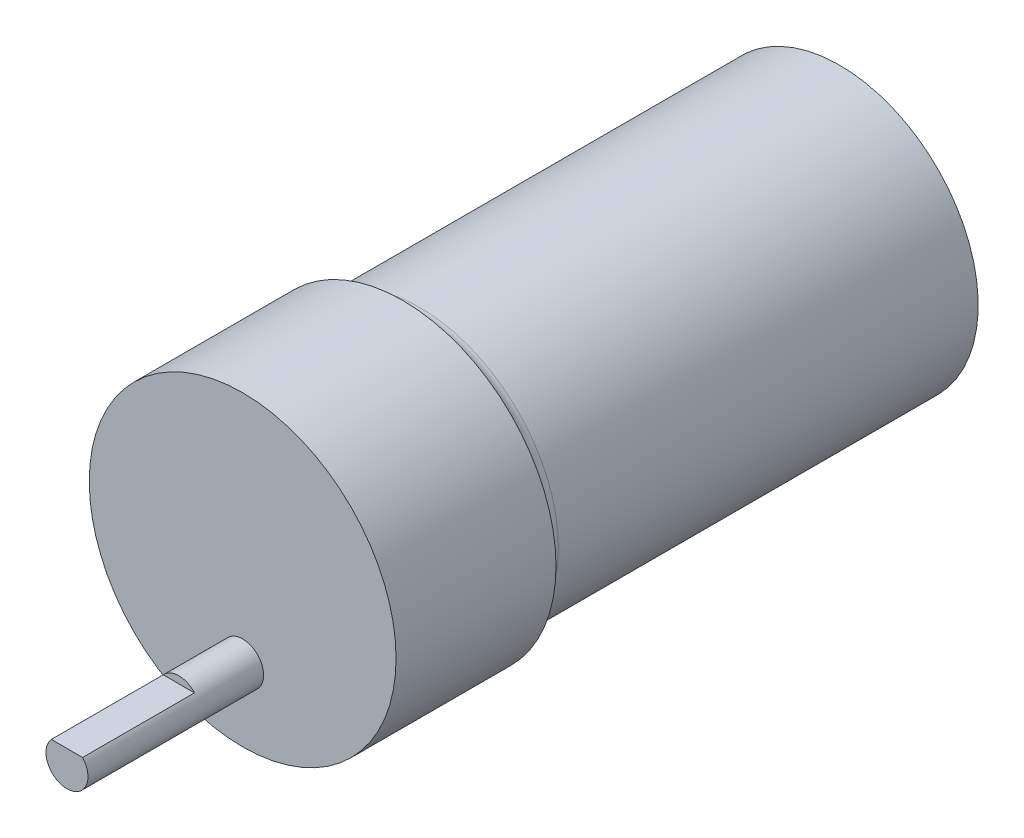
from build123d import *

# Parameters (mm, degrees)
SKETCH2_R           = 17.55
BOSS_EXTRUDE1_DEPTH = 68.3
SKETCH4_R           = 17.55
SKETCH4_R_2         = 15.85
CUT_EXTRUDE1_DEPTH  = 50
SKETCH5_R           = 2.4
BOSS_EXTRUDE3_DEPTH = 20.1
SKETCH6_W           = 4.602135996
SKETCH6_H           = 1.29181111
CUT_EXTRUDE2_DEPTH  = 12.8
FILLET1_R           = 2


with BuildPart() as part:
    # Sketch2 → Boss-Extrude1 (new body)
    with BuildSketch(Plane.XY):
        Circle(SKETCH2_R)
    extrude(amount=BOSS_EXTRUDE1_DEPTH)

    # Sketch4 → Cut-Extrude1 (cut)
    with BuildSketch(Plane(origin=(0, 0, 0), x_dir=(-1, 0, 0), z_dir=(0, 0, -1))):
        Circle(SKETCH4_R)
        Circle(SKETCH4_R_2, mode=Mode.SUBTRACT)
    extrude(amount=-CUT_EXTRUDE1_DEPTH, mode=Mode.SUBTRACT)

    # Sketch5 → Boss-Extrude3 (add)
    with BuildSketch(Plane.XY.offset(68.3)):
        with Locations((0, -9.25)):
            Circle(SKETCH5_R)
    extrude(amount=BOSS_EXTRUDE3_DEPTH)

    # Sketch6 → Cut-Extrude2 (cut)
    with BuildSketch(Plane.XY.offset(88.4)):
        with Locations((0.017586897, -7.004094445)):
            Rectangle(SKETCH6_W, SKETCH6_H)
    extrude(amount=-CUT_EXTRUDE2_DEPTH, mode=Mode.SUBTRACT)

    # Fillet1
    # the kernel refuses this fillet: 2 mm, written as the material it adds along each edge
    with BuildSketch(Plane(origin=(0, 0, 50), x_dir=(-1, 0, 0), z_dir=(0, -1, 0))) as fillet1_piece_1:
        with BuildLine():
            CenterArc((17.85, 1.977371993), FILLET1_R, 180, 81.373073441)
            Line((15.85, 1.977371993), (15.81, 1.977371993))
            Line((15.81, 1.977371993), (15.81, 0))
            Line((15.81, 0), (15.85, -0.04))
            ThreePointArc((15.85, -0.04), (16.7, -0.04), (17.544, -0.03954744))
            Line((17.544, -0.03954744), (17.55, 0))
        make_face()
    revolve(axis=Axis((0, 0, 50), (0, 0, -1)))


solid = part.part
